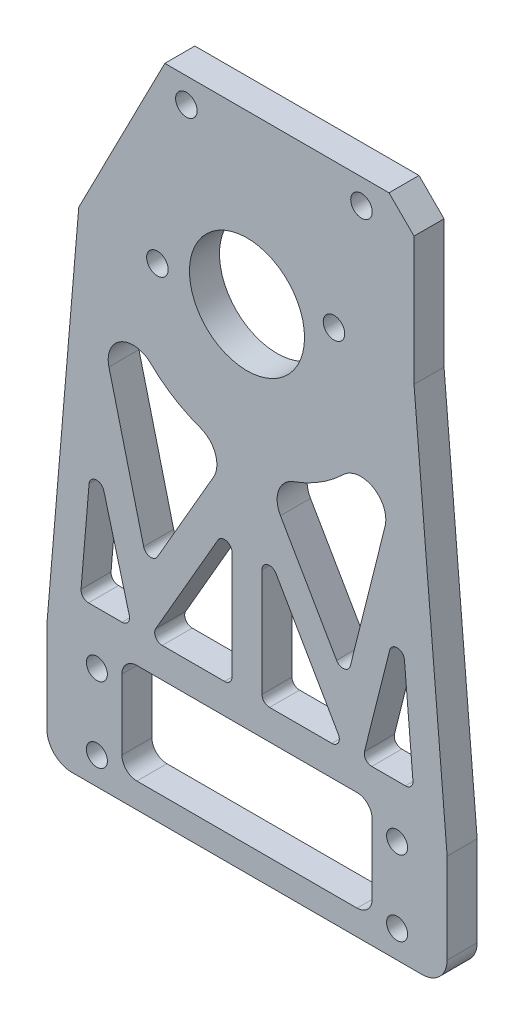
from build123d import *

# Parameters (mm, degrees)
SKETCH_1_R                   = 33.5
SKETCH_1_R_2                 = 11.5
SKETCH_1_W                   = 80
SKETCH_1_H                   = 20
SKETCH_1_R_3                 = 2.1
EXTRUDE_1_DEPTH              = 6
SKETCH_3_W                   = 80
SKETCH_3_H                   = 3
EXTRUDE_2_DEPTH              = 6
FILLET_1_R                   = 5
EXTRUDE_START                = -6
EXTRUDE_3_DEPTH              = 6
SKETCH_5_R                   = 2
CUT_EXTRUDE_1_DEPTH          = 126.686116974
HOLE_WIZARD_M4_1_D           = 4.3
HOLE_WIZARD_M4_1_DEPTH       = 10
HOLE_WIZARD_M4_1_CSINK_D     = 8.96
HOLE_WIZARD_M4_1_CSINK_ANGLE = 90
HOLE_WIZARD_M4_1_TIP         = 1.291850331
SKETCH_8_R                   = 2.1
CUT_EXTRUDE_2_DEPTH          = 10
HOLE_WIZARD_M4_2_D           = 4.3
HOLE_WIZARD_M4_2_DEPTH       = 10
HOLE_WIZARD_M4_2_CSINK_D     = 8.96
HOLE_WIZARD_M4_2_CSINK_ANGLE = 90
HOLE_WIZARD_M4_2_TIP         = 1.291850331
CHAMFER_1_SIZE               = 5
CUT_EXTRUDE_3_DEPTH          = 126.686116974
SKETCH_13_W                  = 50
SKETCH_13_H                  = 20
CUT_EXTRUDE_5_DEPTH          = 10
FILLET_3_R                   = 3
FILLET_4_R                   = 6
FILLET_5_R                   = 5
FILLET_6_R                   = 1.5
FILLET_7_R                   = 5


with BuildPart() as part:
    # 草图1 → 凸台-拉伸1 (new body)
    # profile 1 of 3: a face of its own
    with BuildSketch(Plane.XY):
        with Locations((0, 85.5)):
            Circle(SKETCH_1_R)
        with Locations((0, 85.5)):
            Circle(SKETCH_1_R_2, mode=Mode.SUBTRACT)
    # profile 2 of 3: a face of its own
    with BuildSketch(Plane.XY):
        with BuildLine():
            Line((-33.38100662, 88.32106311), (-40, 10))
            Line((-40, 10), (40, 10))
            Line((40, 10), (33.38100662, 88.32106311))
            ThreePointArc((33.38100662, 88.32106311), (33.470238435, 86.911785792), (33.5, 85.5))
            ThreePointArc((33.5, 85.5), (-1.411785792, 52.029761565), (-33.38100662, 88.32106311))
        make_face()
    # profile 3 of 3: a face of its own
    with BuildSketch(Plane.XY):
        Rectangle(SKETCH_1_W, SKETCH_1_H)
        with Locations((-30, 7.5)):
            Circle(SKETCH_1_R_3, mode=Mode.SUBTRACT)
        with Locations((30, 7.5)):
            Circle(SKETCH_1_R_3, mode=Mode.SUBTRACT)
        with Locations((30, -7.5)):
            Circle(SKETCH_1_R_3, mode=Mode.SUBTRACT)
        with Locations((-30, -7.5)):
            Circle(SKETCH_1_R_3, mode=Mode.SUBTRACT)
    extrude(amount=EXTRUDE_1_DEPTH)

    # 草图3 → 凸台-拉伸2 (add)
    with BuildSketch(Plane.XY.offset(6)):
        with Locations((0, -11.5)):
            Rectangle(SKETCH_3_W, SKETCH_3_H)
    extrude(amount=-EXTRUDE_2_DEPTH)

    # 圆角1
    fillet_1_edges = [part.edges().sort_by_distance(p)[0] for p in [
        (-40, -13, 3),
        (40, -13, 3),
    ]]
    fillet(fillet_1_edges, radius=FILLET_1_R)

    # 草图4 → 凸台-拉伸3 (add)
    with BuildSketch(Plane.XY.offset(6).offset(EXTRUDE_START)):
        with BuildLine():
            Line((33.38100662, 88.32106311), (11.148614395, 88.32106311))
            ThreePointArc((11.148614395, 88.32106311), (-1.418941021, 96.91212541), (-11.499998905, 85.50501918))
            Line((-11.499998905, 85.50501918), (-33.61899338, 85.50501918))
            Line((-33.61899338, 85.50501918), (-33.61899338, 119))
            Line((-33.61899338, 119), (33.38100662, 119))
            Line((33.38100662, 119), (33.38100662, 88.32106311))
        make_face()
    extrude(amount=EXTRUDE_3_DEPTH)

    # 草图5 → 切除-拉伸1 (cut, through all)
    with BuildSketch(Plane.XY.offset(6)):
        with Locations((-17.901394117, 83.618487661)):
            Circle(SKETCH_5_R)
        with Locations((17.386664873, 90.158742812)):
            Circle(SKETCH_5_R)
    extrude(amount=-CUT_EXTRUDE_1_DEPTH, mode=Mode.SUBTRACT)

    # M4 六角凹锥坑螺钉的锥形沉头孔1
    with Locations(Plane(origin=(0, 0, 0), x_dir=(-1, 0, 0), z_dir=(0, 0, -1))):
        with Locations((-17.386664873, 90.158742812), (17.901394117, 83.618487661)):
            CounterSinkHole(HOLE_WIZARD_M4_1_D / 2, HOLE_WIZARD_M4_1_CSINK_D / 2, depth=HOLE_WIZARD_M4_1_DEPTH, counter_sink_angle=HOLE_WIZARD_M4_1_CSINK_ANGLE)
            with Locations((0, 0, -(HOLE_WIZARD_M4_1_DEPTH + HOLE_WIZARD_M4_1_TIP / 2))):  # 118° drill point
                Cone(0, HOLE_WIZARD_M4_1_D / 2, HOLE_WIZARD_M4_1_TIP, mode=Mode.SUBTRACT)

    # 草图8 → 切除-拉伸2 (cut)
    with BuildSketch(Plane.XY.offset(6)):
        with Locations((-12.118993381, 114)):
            Circle(SKETCH_8_R)
        with Locations((22.881006619, 114)):
            Circle(SKETCH_8_R)
    extrude(amount=-CUT_EXTRUDE_2_DEPTH, mode=Mode.SUBTRACT)

    # M4 六角凹锥坑螺钉的锥形沉头孔2
    with Locations(Plane(origin=(0, 0, 0), x_dir=(-1, 0, 0), z_dir=(0, 0, -1))):
        with Locations((-22.881006619, 114), (12.118993381, 114)):
            CounterSinkHole(HOLE_WIZARD_M4_2_D / 2, HOLE_WIZARD_M4_2_CSINK_D / 2, depth=HOLE_WIZARD_M4_2_DEPTH, counter_sink_angle=HOLE_WIZARD_M4_2_CSINK_ANGLE)
            with Locations((0, 0, -(HOLE_WIZARD_M4_2_DEPTH + HOLE_WIZARD_M4_2_TIP / 2))):  # 118° drill point
                Cone(0, HOLE_WIZARD_M4_2_D / 2, HOLE_WIZARD_M4_2_TIP, mode=Mode.SUBTRACT)

    # 倒角1
    chamfer_1_edges = [part.edges().sort_by_distance(p)[0] for p in [
        (33.38100662, 119, 3),
    ]]
    chamfer(chamfer_1_edges, length=CHAMFER_1_SIZE)

    # 草图11 → 切除-拉伸3 (cut, through all)
    with BuildSketch(Plane.XY.offset(6)):
        Polygon((-33.61899338, 119), (-16.422785999, 119), (-33.61899338, 85.50501918), align=None)
    extrude(amount=-CUT_EXTRUDE_3_DEPTH, mode=Mode.SUBTRACT)

    # 草图13 → 切除-拉伸5 (cut)
    with BuildSketch(Plane.XY.offset(6)):
        with BuildLine():
            Line((-29.15457937, 67.081692819), (-19.750016495, 29.647135893))
            Line((-19.750016495, 29.647135893), (-3.346711376, 58.058493772))
            ThreePointArc((-3.346711376, 58.058493772), (-20.530627933, 66.987030012), (-27.640305628, 84.999754146))
            Line((-27.640305628, 84.999754146), (-29.15457937, 67.081692819))
        make_face()
        Polygon((-24.106901542, 22.100789629), (-30.830808938, 47.247244556), (-33.302523575, 18), (-23.010391923, 18), align=None)
        Polygon((-3, 46.65901549), (-17.649366774, 21.285567939), (-19.546290308, 18), (-3, 18), align=None)
        with BuildLine():
            Line((29.15457937, 67.081692819), (27.640305628, 84.999754146))
            ThreePointArc((27.640305628, 84.999754146), (20.530627933, 66.987030012), (3.346711376, 58.058493772))
            Line((3.346711376, 58.058493772), (19.750016495, 29.647135893))
            Line((19.750016495, 29.647135893), (29.15457937, 67.081692819))
        make_face()
        Polygon((17.649366774, 21.285567939), (3, 46.65901549), (3, 18), (19.546290308, 18), align=None)
        Polygon((33.302523575, 18), (30.711815557, 48.65526652), (24.060716784, 22.180783977), (23.010391923, 18), align=None)
        with Locations((0, 2)):
            Rectangle(SKETCH_13_W, SKETCH_13_H)
    extrude(amount=-CUT_EXTRUDE_5_DEPTH, mode=Mode.SUBTRACT)

    # 圆角3
    fillet_3_edges = [part.edges().sort_by_distance(p)[0] for p in [
        (25, -8, 3),
        (-25, -8, 3),
        (-25, 12, 3),
        (25, 12, 3),
    ]]
    fillet(fillet_3_edges, radius=FILLET_3_R)

    # 圆角4
    # the kernel refuses this fillet: 6 mm, written as the material it adds along each edge
    with BuildSketch(Plane(origin=(27.640305628, 84.999754146, 6), x_dir=(0.08421083909463391, -0.996447958791114, 0), z_dir=(0, 0, -1))) as fillet_4_piece_1:
        with BuildLine():
            CenterArc((21.827755911, 4.605393907), FILLET_4_R, 137.118904636, 93.016882278)
            Line((17.431151142, 8.688268692), (17.343219046, 8.769926188))
            ThreePointArc((17.343219046, 8.769926188), (9.452514246, 2.865624658), (-0.012267388, 0.119371316))
            Line((-0.012267388, 0.119371316), (0, -0.12))
            ThreePointArc((0, -0.12), (8.990966949, -0.12), (17.905017457, -0.092107878))
            Line((17.905017457, -0.092107878), (17.981933897, 0))
        make_face()
    extrude(amount=6)
    with BuildSketch(Plane(origin=(-27.640305628, 84.999754146, 6), x_dir=(-0.08421083909464076, -0.9964479587911135, 0), z_dir=(0, 0, -1))) as fillet_4_piece_2:
        with BuildLine():
            CenterArc((21.827755911, -4.605393907), FILLET_4_R, 129.864213086, 93.016882278)
            Line((17.431151142, -8.688268692), (17.343219046, -8.769926188))
            ThreePointArc((17.343219046, -8.769926188), (9.452514246, -2.865624658), (-0.012267388, -0.119371316))
            Line((-0.012267388, -0.119371316), (0, 0.12))
            ThreePointArc((0, 0.12), (8.990966949, 0.12), (17.905017457, 0.092107878))
            Line((17.905017457, 0.092107878), (17.981933897, 0))
        make_face()
    extrude(amount=6)

    # 圆角5
    fillet_5_edges = [part.edges().sort_by_distance(p)[0] for p in [
        (3.346711376, 58.058493772, 3),
        (-3.346711376, 58.058493772, 3),
    ]]
    fillet(fillet_5_edges, radius=FILLET_5_R)

    # 圆角6
    fillet_6_edges = [part.edges().sort_by_distance(p)[0] for p in [
        (19.546290308, 18, 3),
        (3, 18, 3),
        (3, 46.65901549, 3),
        (19.750016495, 29.647135893, 3),
        (-19.546290308, 18, 3),
        (-3, 46.65901549, 3),
        (-3, 18, 3),
        (-23.010391923, 18, 3),
        (-33.302523575, 18, 3),
        (-30.830808938, 47.247244556, 3),
        (23.010391923, 18, 3),
        (30.711815557, 48.65526652, 3),
        (33.302523575, 18, 3),
        (-19.750016495, 29.647135893, 3),
    ]]
    fillet(fillet_6_edges, radius=FILLET_6_R)

    # 圆角7
    # the kernel refuses this fillet: 5 mm, written as the material it adds along each edge
    with BuildSketch(Plane(origin=(29.15457937, 67.081692819, 6), x_dir=(-0.2436552741241345, -0.9698619011959861, 0), z_dir=(0, 0, -1))) as fillet_7_piece_1:
        with BuildLine():
            CenterArc((6.41210713, 5), FILLET_7_R, 121.736562988, 148.263437012)
            Line((3.782034708, 9.252378047), (3.519027465, 9.677615851))
            ThreePointArc((3.519027465, 9.677615851), (2.06186763, 8.837638689), (-0.427669644, -0.25903412))
            Line((-0.427669644, -0.25903412), (0, -0.5))
            Line((0, -0.5), (6.41210713, -0.5))
            Line((6.41210713, -0.5), (6.41210713, 0))
        make_face()
    extrude(amount=6)
    with BuildSketch(Plane(origin=(-29.15457937, 67.081692819, 6), x_dir=(0.24365527412411786, -0.9698619011959904, 0), z_dir=(0, 0, -1))) as fillet_7_piece_2:
        with BuildLine():
            CenterArc((6.41210713, -5), FILLET_7_R, 90, 148.263437012)
            Line((3.782034708, -9.252378047), (3.519027465, -9.677615851))
            ThreePointArc((3.519027465, -9.677615851), (2.06186763, -8.837638689), (-0.427669644, 0.25903412))
            Line((-0.427669644, 0.25903412), (0, 0.5))
            Line((0, 0.5), (6.41210713, 0.5))
            Line((6.41210713, 0.5), (6.41210713, 0))
        make_face()
    extrude(amount=6)


solid = part.part
